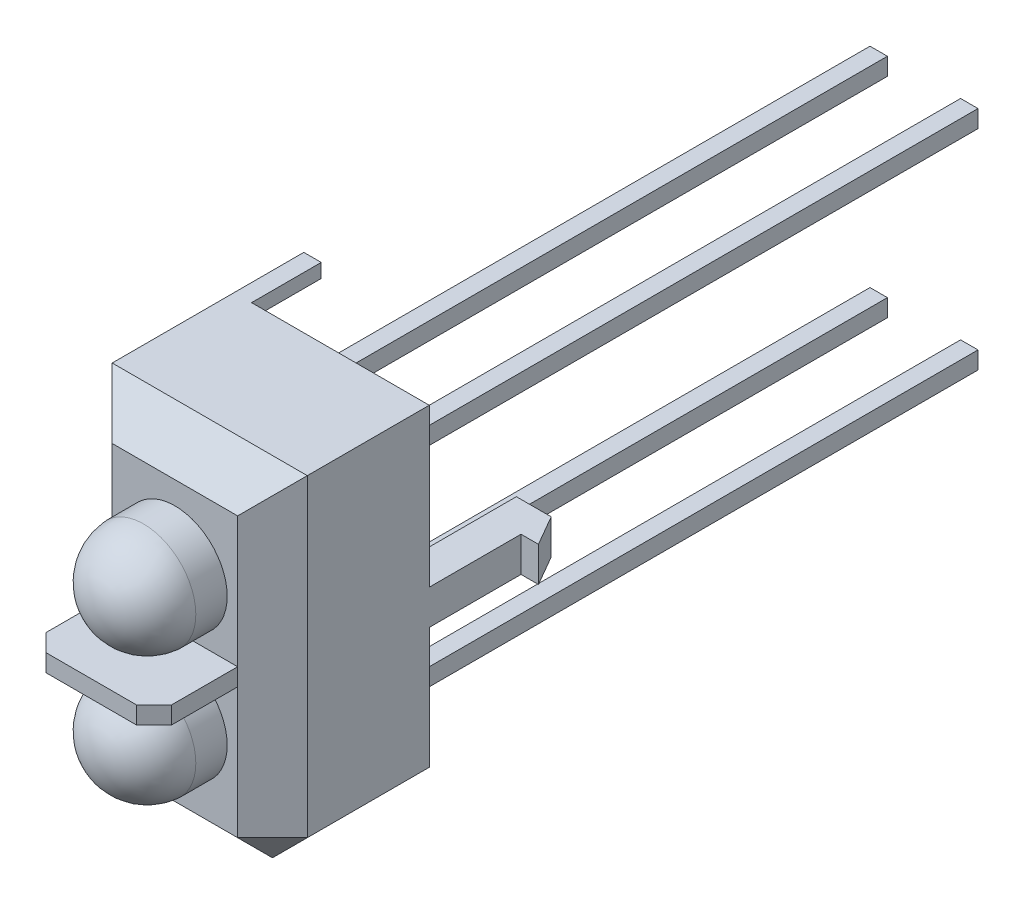
from build123d import *

# Parameters (mm, degrees)
SKETCH1_W               = 5.6
SKETCH1_H               = 10
BOSS_EXTRUDE1_DEPTH     = 4.5
CHAMFER1_SIZE           = 1
SKETCH2_R               = 1.5
BOSS_EXTRUDE2_DEPTH     = 0.9
SKETCH3_W               = 3.6
SKETCH3_H               = 0.5
BOSS_EXTRUDE3_DEPTH     = 2.4
CHAMFER2_SIZE           = 0.5
SKETCH4_W               = 3.5
SKETCH4_H               = 1
BOSS_EXTRUDE4_DEPTH     = 1
BOSS_EXTRUDE5_DEPTH     = 1
SKETCH6_W               = 2
SKETCH6_H               = 0.4
BOSS_EXTRUDE6_DEPTH     = 0.5
SKETCH7_W               = 0.5
SKETCH7_H               = 0.5
BOSS_EXTRUDE7_DEPTH     = 17
MIRROR3_COPY_1_SKETCH_W = 0.5
MIRROR3_COPY_1_SKETCH_H = 0.5
MIRROR3_COPY_1_DEPTH    = 17


# Read off the part's stored shape, not the designer's step: Dome1, Dome2
with BuildPart() as part:
    # Sketch1 → Boss-Extrude1 (new body)
    with BuildSketch(Plane.XY):
        Rectangle(SKETCH1_W, SKETCH1_H)
    extrude(amount=BOSS_EXTRUDE1_DEPTH)

    # Chamfer1
    chamfer1_edges = [part.edges().sort_by_distance(p)[0] for p in [
        (-2.8, 0, 4.5),
        (0, -5, 4.5),
        (2.8, 0, 4.5),
        (0, 5, 4.5),
        (2.8, -5, 2.25),
        (-2.8, -5, 2.25),
    ]]
    chamfer(chamfer1_edges, length=CHAMFER1_SIZE)

    # Sketch2 → Boss-Extrude2 (add)
    with BuildSketch(Plane.XY.offset(4.5)):
        with Locations((0, 1.85)):
            Circle(SKETCH2_R)
        with Locations((0, -1.85)):
            Circle(SKETCH2_R)
    extrude(amount=BOSS_EXTRUDE2_DEPTH)

    # Dome1 outline → Dome1 (revolve)
    with BuildSketch(Plane.XZ.offset(-1.85)):
        with BuildLine():
            Line((0, 5.4), (1.5, 5.399999999))
            ThreePointArc((1.5, 5.399999999), (1.025914227, 6.395622385), (0, 6.8))
            Line((0, 6.8), (0, 5.4))
        make_face()
    revolve(axis=Axis((0, 1.85, 0), (0, 0, 1)))

    # Dome2 outline → Dome2 (revolve)
    with BuildSketch(Plane.XZ.offset(1.85)):
        with BuildLine():
            Line((0, 5.4), (1.5, 5.399999999))
            ThreePointArc((1.5, 5.399999999), (1.025914227, 6.395622385), (0, 6.8))
            Line((0, 6.8), (0, 5.4))
        make_face()
    revolve(axis=Axis((0, -1.85, 0), (0, 0, 1)))

    # Sketch3 → Boss-Extrude3 (add)
    with BuildSketch(Plane.XY.offset(4.5)):
        Rectangle(SKETCH3_W, SKETCH3_H)
    extrude(amount=BOSS_EXTRUDE3_DEPTH)

    # Chamfer2
    chamfer2_edges = [part.edges().sort_by_distance(p)[0] for p in [
        (1.8, 0, 6.9),
        (-1.8, 0, 6.9),
    ]]
    chamfer(chamfer2_edges, length=CHAMFER2_SIZE)

    # Sketch4 → Boss-Extrude4 (add)
    with BuildSketch(Plane(origin=(2.8, 0, 0), x_dir=(0, 0, -1), z_dir=(1, 0, 0))):
        with Locations((1.75, -0.023003027)):
            Rectangle(SKETCH4_W, SKETCH4_H)
    boss_extrude4 = extrude(amount=-BOSS_EXTRUDE4_DEPTH)

    # Sketch5 → Boss-Extrude5 (add)
    with BuildSketch(Plane.XZ.offset(0.523003027)):
        Polygon((2.8, -2.633974596), (2.8, -3.5), (3.3, -2.633974596), align=None)
    boss_extrude5 = extrude(amount=-BOSS_EXTRUDE5_DEPTH)

    # Mirror1: Boss-Extrude4, Boss-Extrude5 across plane
    add(boss_extrude4.mirror(Plane(origin=(0, 0, 0), x_dir=(0, 0, 1), z_dir=(1, 0, 0))))
    add(boss_extrude5.mirror(Plane(origin=(0, 0, 0), x_dir=(0, 0, 1), z_dir=(1, 0, 0))))

    # Sketch6 → Boss-Extrude6 (add)
    with BuildSketch(Plane.ZY.offset(2.8)):
        with Locations((-1, 4.8)):
            Rectangle(SKETCH6_W, SKETCH6_H)
    extrude(amount=-BOSS_EXTRUDE6_DEPTH)

    # Sketch7 → Boss-Extrude7 (add)
    with BuildSketch(Plane(origin=(0, 0, 0), x_dir=(-1, 0, 0), z_dir=(0, 0, -1))):
        with Locations((1.3, 3)):
            Rectangle(SKETCH7_W, SKETCH7_H)
    boss_extrude7 = extrude(amount=BOSS_EXTRUDE7_DEPTH)

    # Mirror2: Boss-Extrude7 across plane
    add(boss_extrude7.mirror(Plane(origin=(0, 0, 0), x_dir=(0, 0, 1), z_dir=(1, 0, 0))))

    # Mirror3: Boss-Extrude7 across plane
    add(boss_extrude7.mirror(Plane(origin=(0, 0, 0), x_dir=(0, 0, 1), z_dir=(0, -1, 0))))

    # Mirror3 copy 1 sketch → Mirror3 copy 1 (add)
    with BuildSketch(Plane(origin=(0, 0, 0), x_dir=(1, 0, 0), z_dir=(0, 0, -1))):
        with Locations((1.3, 3)):
            Rectangle(MIRROR3_COPY_1_SKETCH_W, MIRROR3_COPY_1_SKETCH_H)
    extrude(amount=MIRROR3_COPY_1_DEPTH)


solid = part.part
